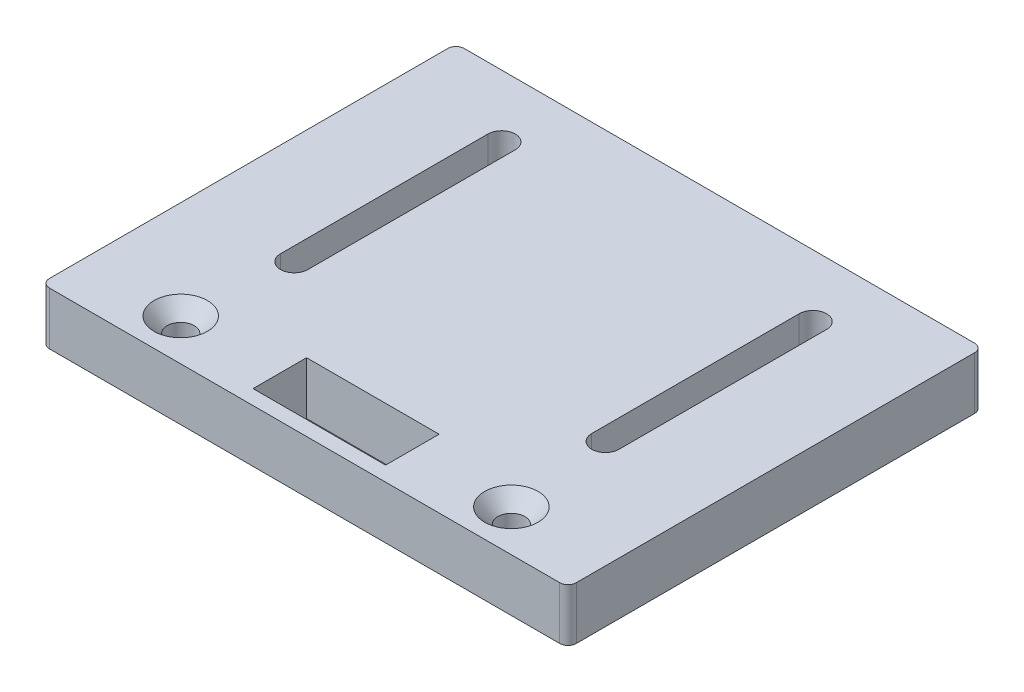
from build123d import *

# Parameters (mm, degrees)
SKETCH1_W                                        = 127
SKETCH1_H                                        = 100
BOSS_EXTRUDE1_DEPTH                              = 12.7
CUT_EXTRUDE1_DEPTH                               = 12.7
CUT_EXTRUDE2_DEPTH                               = 163.142807426
FILLET1_R                                        = 2
CSK_FOR_1_4_FLAT_HEAD_MACHINE_SCREW1_D           = 6.5278
CSK_FOR_1_4_FLAT_HEAD_MACHINE_SCREW1_CSINK_D     = 12.8778
CSK_FOR_1_4_FLAT_HEAD_MACHINE_SCREW1_CSINK_ANGLE = 82


with BuildPart() as part:
    # Sketch1 → Boss-Extrude1 (new body)
    with BuildSketch(Plane(origin=(0, 0, 0), x_dir=(1, 0, 0), z_dir=(0, 1, 0))):
        with Locations((63.5, 50)):
            Rectangle(SKETCH1_W, SKETCH1_H)
    extrude(amount=BOSS_EXTRUDE1_DEPTH)

    # Sketch2 → Cut-Extrude1 (cut)
    with BuildSketch(Plane(origin=(0, 12.7, 0), x_dir=(1, 0, 0), z_dir=(0, 1, 0))):
        Polygon((47.53, 10), (47.53, 16.45), (79.48, 16.45), (79.48, 10), (79.48, 3.55), (47.53, 3.55), align=None)
    extrude(amount=-CUT_EXTRUDE1_DEPTH, mode=Mode.SUBTRACT)

    # Sketch6 → Cut-Extrude2 (cut, through all)
    with BuildSketch(Plane(origin=(0, 12.7, 0), x_dir=(1, 0, 0), z_dir=(0, 1, 0))):
        with BuildLine():
            Line((22.690847092, 35), (22.690847092, 85))
            ThreePointArc((22.690847092, 85), (25.990847092, 88.3), (29.290847092, 85))
            Line((29.290847092, 85), (29.290847092, 35))
            ThreePointArc((29.290847092, 35), (25.990847092, 31.7), (22.690847092, 35))
        make_face()
        with BuildLine():
            Line((97.720847092, 35.000004619), (97.720847092, 84.999995381))
            ThreePointArc((97.720847092, 84.999995381), (100.881876157, 88.297072501), (104.30914268, 85.2776907))
            Line((104.30914268, 85.2776907), (104.30914268, 35.2776907))
            ThreePointArc((104.30914268, 35.2776907), (101.159813412, 31.702927304), (97.720847092, 35.000004619))
        make_face()
    extrude(amount=-CUT_EXTRUDE2_DEPTH, mode=Mode.SUBTRACT)

    # Fillet1
    fillet1_edges = [part.edges().sort_by_distance(p)[0] for p in [
        (127, 6.35, -100),
        (127, 6.35, 0),
        (0, 6.35, 0),
        (0, 6.35, -100),
    ]]
    fillet(fillet1_edges, radius=FILLET1_R)

    # CSK for 1/4 Flat Head Machine Screw1 (through all)
    with Locations(Plane(origin=(23.65, 12.7, -9.996892397), x_dir=(0, 0, 1), z_dir=(0, 1, 0))):
        with Locations((0, 0), (0, 79.7)):
            CounterSinkHole(CSK_FOR_1_4_FLAT_HEAD_MACHINE_SCREW1_D / 2, CSK_FOR_1_4_FLAT_HEAD_MACHINE_SCREW1_CSINK_D / 2, counter_sink_angle=CSK_FOR_1_4_FLAT_HEAD_MACHINE_SCREW1_CSINK_ANGLE)


solid = part.part
